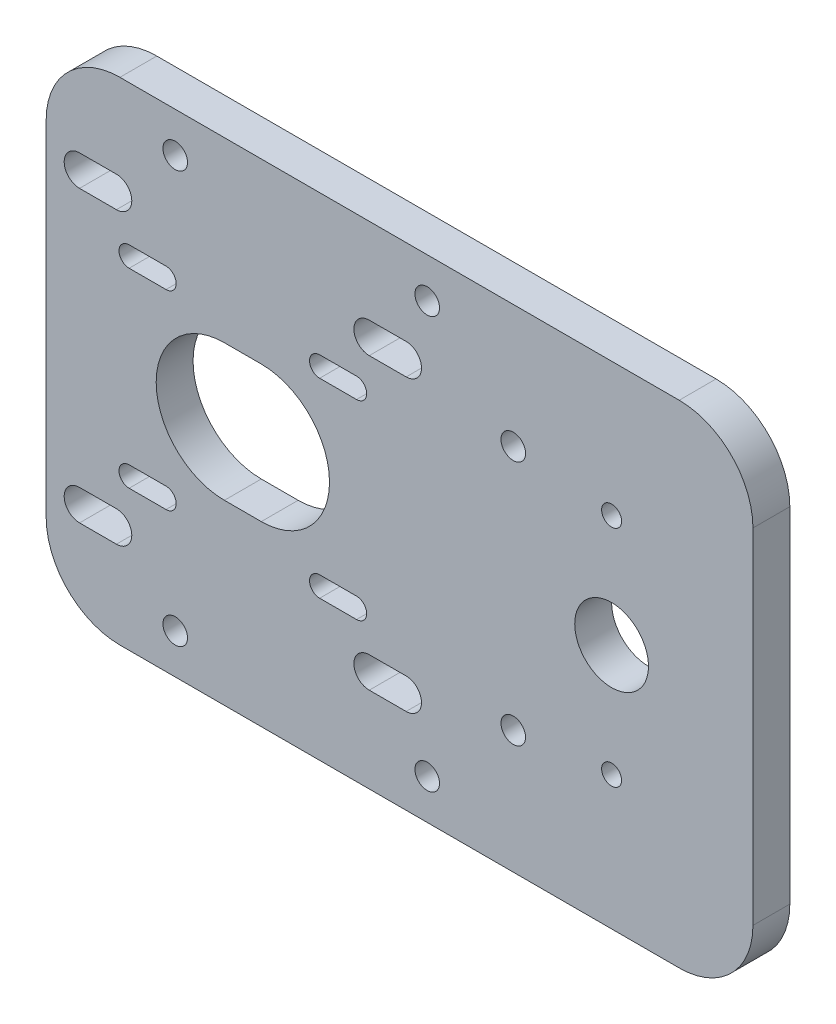
from build123d import *

# Parameters (mm, degrees)
CROQUIS1_W              = 115
CROQUIS1_H              = 80
SALIENTE_EXTRUIR1_DEPTH = 6
CROQUIS2_R              = 6
CROQUIS2_R_2            = 1.625
CROQUIS2_R_3            = 2
CORTAR_EXTRUIR1_DEPTH   = 141.2176879
REDONDEO1_R             = 12
CROQUIS3_R              = 2
CORTAR_EXTRUIR2_DEPTH   = 141.2176879


with BuildPart() as part:
    # Croquis1 → Saliente-Extruir1 (new body)
    with BuildSketch(Plane.XY):
        with Locations((57.5, 40)):
            Rectangle(CROQUIS1_W, CROQUIS1_H)
    extrude(amount=SALIENTE_EXTRUIR1_DEPTH)

    # Croquis2 → Cortar-Extruir1 (cut, through all)
    with BuildSketch(Plane(origin=(0, 0, 0), x_dir=(-1, 0, 0), z_dir=(0, 0, -1))):
        with Locations((-92, 40)):
            Circle(CROQUIS2_R)
        with Locations((-92, 21.75)):
            Circle(CROQUIS2_R_2)
        with Locations((-92, 58.25)):
            Circle(CROQUIS2_R_2)
        with Locations((-76, 20)):
            Circle(CROQUIS2_R_3)
        with Locations((-76, 60)):
            Circle(CROQUIS2_R_3)
        with BuildLine():
            Line((-29, 28.9), (-35, 28.9))
            ThreePointArc((-35, 28.9), (-46.1, 40), (-35, 51.1))
            Line((-35, 51.1), (-29, 51.1))
            ThreePointArc((-29, 51.1), (-17.9, 40), (-29, 28.9))
        make_face()
        with BuildLine():
            Line((-13.5, 22.85), (-19.5, 22.85))
            ThreePointArc((-19.5, 22.85), (-21.15, 24.5), (-19.5, 26.15))
            Line((-19.5, 26.15), (-13.5, 26.15))
            ThreePointArc((-13.5, 26.15), (-11.85, 24.5), (-13.5, 22.85))
        make_face()
        with BuildLine():
            Line((-44.5, 53.85), (-50.5, 53.85))
            ThreePointArc((-50.5, 53.85), (-52.15, 55.5), (-50.5, 57.15))
            Line((-50.5, 57.15), (-44.5, 57.15))
            ThreePointArc((-44.5, 57.15), (-42.85, 55.5), (-44.5, 53.85))
        make_face()
        with BuildLine():
            Line((-44.5, 22.85), (-50.5, 22.85))
            ThreePointArc((-50.5, 22.85), (-52.15, 24.5), (-50.5, 26.15))
            Line((-50.5, 26.15), (-44.5, 26.15))
            ThreePointArc((-44.5, 26.15), (-42.85, 24.5), (-44.5, 22.85))
        make_face()
        with BuildLine():
            Line((-13.5, 53.85), (-19.5, 53.85))
            ThreePointArc((-19.5, 53.85), (-21.15, 55.5), (-19.5, 57.15))
            Line((-19.5, 57.15), (-13.5, 57.15))
            ThreePointArc((-13.5, 57.15), (-11.85, 55.5), (-13.5, 53.85))
        make_face()
        with BuildLine():
            Line((-52.57, 13.93), (-58.57, 13.93))
            ThreePointArc((-58.57, 13.93), (-61.07, 16.43), (-58.57, 18.93))
            Line((-58.57, 18.93), (-52.57, 18.93))
            ThreePointArc((-52.57, 18.93), (-50.07, 16.43), (-52.57, 13.93))
        make_face()
        with BuildLine():
            Line((-5.43, 13.93), (-11.43, 13.93))
            ThreePointArc((-11.43, 13.93), (-13.93, 16.43), (-11.43, 18.93))
            Line((-11.43, 18.93), (-5.43, 18.93))
            ThreePointArc((-5.43, 18.93), (-2.93, 16.43), (-5.43, 13.93))
        make_face()
        with BuildLine():
            Line((-52.57, 61.07), (-58.57, 61.07))
            ThreePointArc((-58.57, 61.07), (-61.07, 63.57), (-58.57, 66.07))
            Line((-58.57, 66.07), (-52.57, 66.07))
            ThreePointArc((-52.57, 66.07), (-50.07, 63.57), (-52.57, 61.07))
        make_face()
        with BuildLine():
            Line((-5.43, 61.07), (-11.43, 61.07))
            ThreePointArc((-11.43, 61.07), (-13.93, 63.57), (-11.43, 66.07))
            Line((-11.43, 66.07), (-5.43, 66.07))
            ThreePointArc((-5.43, 66.07), (-2.93, 63.57), (-5.43, 61.07))
        make_face()
    extrude(amount=-CORTAR_EXTRUIR1_DEPTH, mode=Mode.SUBTRACT)

    # Redondeo1
    redondeo1_edges = [part.edges().sort_by_distance(p)[0] for p in [
        (115, 0, 3),
        (115, 80, 3),
        (0, 0, 3),
        (0, 80, 3),
    ]]
    fillet(redondeo1_edges, radius=REDONDEO1_R)

    # Croquis3 → Cortar-Extruir2 (cut, through all)
    with BuildSketch(Plane(origin=(0, 0, 0), x_dir=(-1, 0, 0), z_dir=(0, 0, -1))):
        with Locations((-21, 6.5)):
            Circle(CROQUIS3_R)
        with Locations((-62, 6.5)):
            Circle(CROQUIS3_R)
        with Locations((-62, 73.5)):
            Circle(CROQUIS3_R)
        with Locations((-21, 73.5)):
            Circle(CROQUIS3_R)
    extrude(amount=-CORTAR_EXTRUIR2_DEPTH, mode=Mode.SUBTRACT)


solid = part.part
